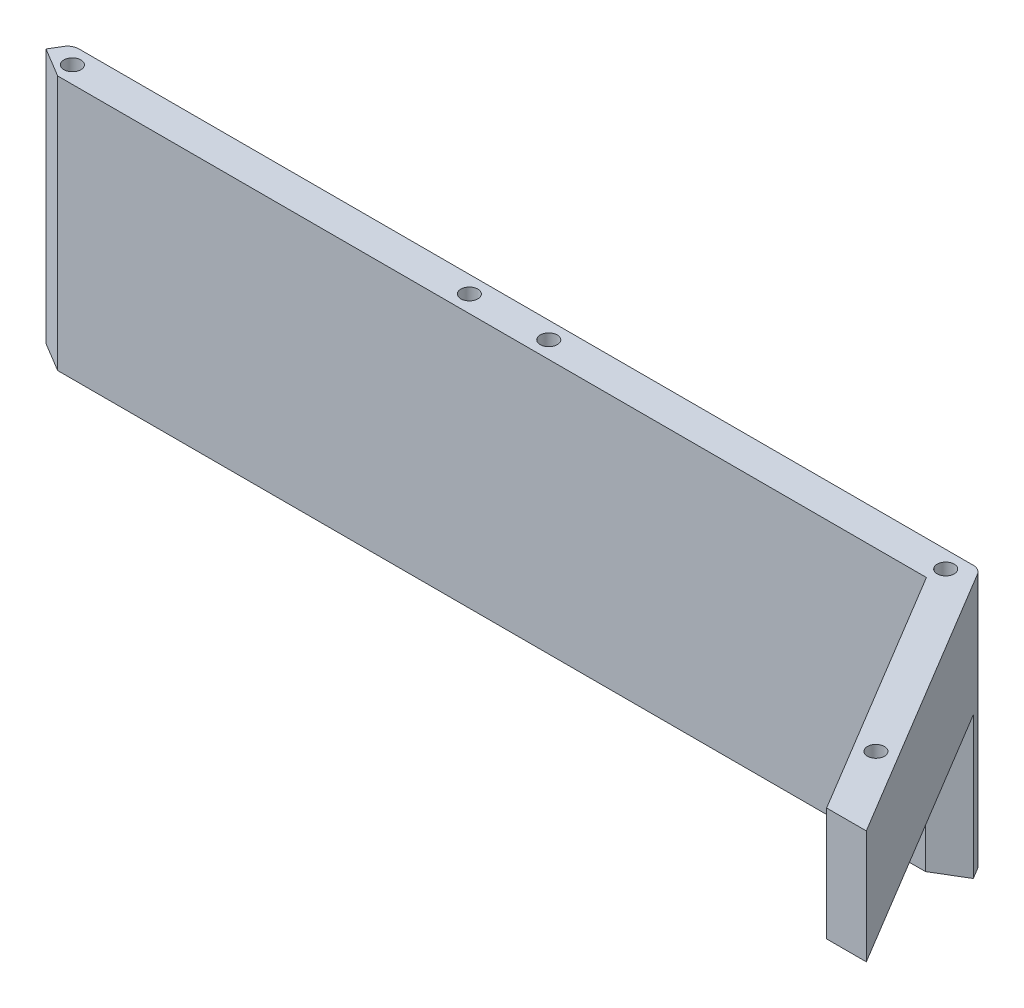
from build123d import *

# Parameters (mm, degrees)
BOSS_EXTRUDE1_DEPTH = 22.5
SKETCH2_R           = 1.5
CUT_EXTRUDE1_DEPTH  = 5
FILLET1_R           = 2
SKETCH4_W           = 55
SKETCH4_H           = 25
CUT_EXTRUDE3_DEPTH  = 10
SKETCH5_W           = 5
SKETCH5_H           = 5
CUT_EXTRUDE4_DEPTH  = 10
SKETCH6_W           = 60
SKETCH6_H           = 45
CUT_EXTRUDE5_DEPTH  = 10


with BuildPart() as part:
    # Sketch1 → Boss-Extrude1 (new, symmetric)
    with BuildSketch(Plane(origin=(0, 0, 0), x_dir=(1, 0, 0), z_dir=(0, 1, 0))):
        Polygon((-110, 0), (-80, 50), (80, 50), (110, 0), (103, 0), (76.6, 44), (-76.6, 44), (-103, 0), align=None)
    extrude(amount=BOSS_EXTRUDE1_DEPTH, both=True)

    # Sketch2 → Cut-Extrude1 (cut)
    with BuildSketch(Plane(origin=(0, 22.5, 0), x_dir=(1, 0, 0), z_dir=(0, 1, 0))):
        with Locations((-98.701428863, 13)):
            Circle(SKETCH2_R)
        with Locations((-77, 47)):
            Circle(SKETCH2_R)
        with Locations((-7, 47)):
            Circle(SKETCH2_R)
        with Locations((7, 47)):
            Circle(SKETCH2_R)
        with Locations((77, 47)):
            Circle(SKETCH2_R)
        with Locations((98.701428863, 13)):
            Circle(SKETCH2_R)
    extrude(amount=-CUT_EXTRUDE1_DEPTH, mode=Mode.SUBTRACT)

    # Fillet1
    fillet1_edges = [part.edges().sort_by_distance(p)[0] for p in [
        (80, 0, -50),
        (-80, 0, -50),
    ]]
    fillet(fillet1_edges, radius=FILLET1_R)

    # Sketch4 → Cut-Extrude3 (cut)
    with BuildSketch(Plane(origin=(80.882352941, 0, -48.529411765), x_dir=(-0.5144957554275265, 0, -0.8574929257125443), z_dir=(0.8574929257125443, 0, -0.5144957554275265))):
        with Locations((-29.094533097, -10)):
            Rectangle(SKETCH4_W, SKETCH4_H)
    extrude(amount=-CUT_EXTRUDE3_DEPTH, mode=Mode.SUBTRACT)

    # Sketch5 → Cut-Extrude4 (cut)
    with BuildSketch(Plane(origin=(-75.735294118, 0, -45.441176471), x_dir=(0.5144957554275261, 0, -0.8574929257125445), z_dir=(0.8574929257125444, 0, 0.514495755427526))):
        with Locations((-54.094533097, -20)):
            Rectangle(SKETCH5_W, SKETCH5_H)
    extrude(amount=-CUT_EXTRUDE4_DEPTH, mode=Mode.SUBTRACT)

    # Sketch6 → Cut-Extrude5 (cut)
    with BuildSketch(Plane(origin=(-75.735294118, 0, -45.441176471), x_dir=(0.5144957554275261, 0, -0.8574929257125445), z_dir=(0.8574929257125444, 0, 0.514495755427526))):
        with Locations((-31.680686134, 0)):
            Rectangle(SKETCH6_W, SKETCH6_H)
    extrude(amount=-CUT_EXTRUDE5_DEPTH, mode=Mode.SUBTRACT)


solid = part.part
